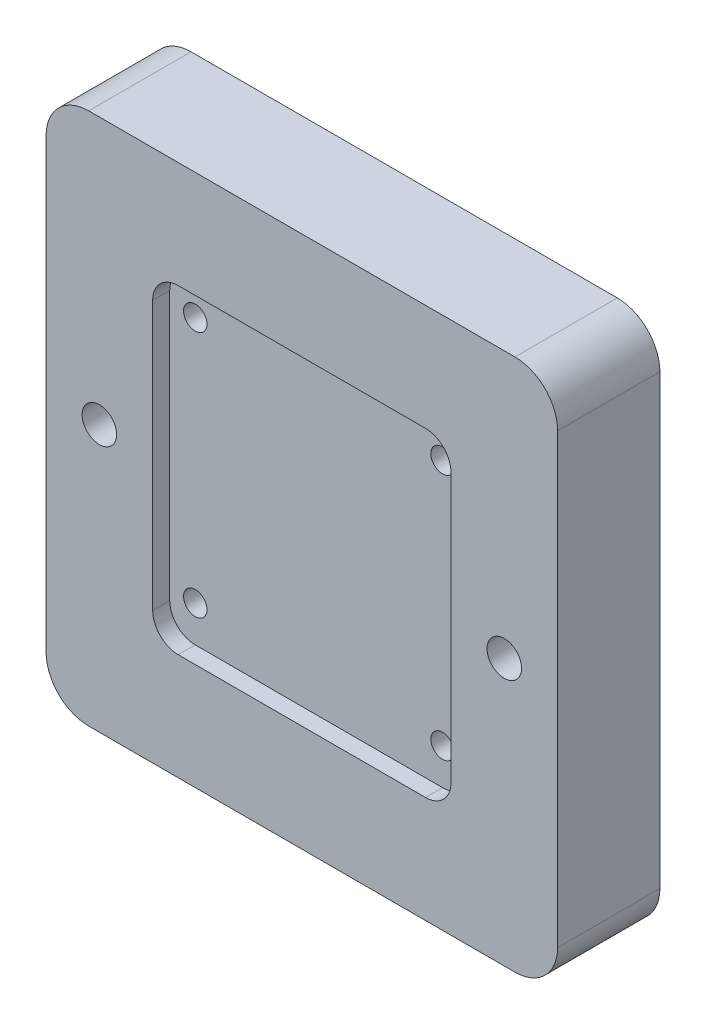
from build123d import *

# Parameters (mm, degrees)
BOSS_EXTRUDE1_DEPTH     = 4
BOSS_EXTRUDE2_DEPTH     = 20
CUT_EXTRUDE1_DEPTH      = 89.917096219
CUT_EXTRUDE1_DEPTH_BACK = 89.917096219
SKETCH8_R               = 2.75
CUT_EXTRUDE2_START      = -7
CUT_EXTRUDE2_DEPTH      = 97.901334807
CUT_EXTRUDE3_DEPTH      = 90.901334807
CUT_EXTRUDE3_DEPTH_BACK = 20
SKETCH10_R              = 4.05


with BuildPart() as part:
    # Sketch1 → Boss-Extrude1 (new body)
    with BuildSketch(Plane.XY):
        with BuildLine():
            Line((-50, 62.5), (50, 62.5))
            ThreePointArc((50, 62.5), (57.071067812, 59.571067812), (60, 52.5))
            Line((60, 52.5), (60, -52.5))
            ThreePointArc((60, -52.5), (57.071067812, -59.571067812), (50, -62.5))
            Line((50, -62.5), (-50, -62.5))
            ThreePointArc((-50, -62.5), (-57.071067812, -59.571067812), (-60, -52.5))
            Line((-60, -52.5), (-60, 52.5))
            ThreePointArc((-60, 52.5), (-57.071067812, 59.571067812), (-50, 62.5))
        make_face()
        with BuildLine():
            Line((-29, 37.5), (29, 37.5))
            ThreePointArc((29, 37.5), (33.242640687, 35.742640687), (35, 31.5))
            Line((35, 31.5), (35, -31.5))
            ThreePointArc((35, -31.5), (33.242640687, -35.742640687), (29, -37.5))
            Line((29, -37.5), (-29, -37.5))
            ThreePointArc((-29, -37.5), (-33.242640687, -35.742640687), (-35, -31.5))
            Line((-35, -31.5), (-35, 31.5))
            ThreePointArc((-35, 31.5), (-33.242640687, 35.742640687), (-29, 37.5))
        make_face(mode=Mode.SUBTRACT)
    extrude(amount=-BOSS_EXTRUDE1_DEPTH)

    # Sketch2 → Boss-Extrude2 (add)
    with BuildSketch(Plane.XY.offset(-4)):
        with BuildLine():
            Line((-50, -62.5), (50, -62.5))
            ThreePointArc((50, -62.5), (57.071067812, -59.571067812), (60, -52.5))
            Line((60, -52.5), (60, 52.5))
            ThreePointArc((60, 52.5), (57.071067812, 59.571067812), (50, 62.5))
            Line((50, 62.5), (-50, 62.5))
            ThreePointArc((-50, 62.5), (-57.071067812, 59.571067812), (-60, 52.5))
            Line((-60, 52.5), (-60, -52.5))
            ThreePointArc((-60, -52.5), (-57.071067812, -59.571067812), (-50, -62.5))
        make_face()
    extrude(amount=-BOSS_EXTRUDE2_DEPTH)

    # Sketch8 → Cut-Extrude1 (cut, two sides: drawn at the far end of the back side and taken through both)
    with BuildSketch(Plane.XY.offset(-4).offset(-CUT_EXTRUDE1_DEPTH_BACK)):
        with Locations((-29, 29)):
            Circle(SKETCH8_R)
        with Locations((29, 29)):
            Circle(SKETCH8_R)
        with Locations((29, -29)):
            Circle(SKETCH8_R)
        with Locations((-29, -29)):
            Circle(SKETCH8_R)
    extrude(amount=CUT_EXTRUDE1_DEPTH + CUT_EXTRUDE1_DEPTH_BACK, mode=Mode.SUBTRACT)

    # Sketch9 → Cut-Extrude2 (cut)
    with BuildSketch(Plane(origin=(0, 0, -24), x_dir=(-1, 0, 0), z_dir=(0, 0, -1)).offset(CUT_EXTRUDE2_START)):
        Polygon((-33.1, 26.632863896), (-29, 24.265727793), (-24.9, 26.632863896), (-24.9, 31.367136104), (-29, 33.734272207), (-33.1, 31.367136104), align=None)
    cut_extrude2 = extrude(amount=CUT_EXTRUDE2_DEPTH, mode=Mode.SUBTRACT)

    # Sketch-Pattern1: Cut-Extrude2 at 3 more places
    with Locations((-58, 0, 0), (0, -58, 0), (-58, -58, 0)):
        add(cut_extrude2, mode=Mode.SUBTRACT)

    # Sketch10 → Cut-Extrude3 (cut, two sides: drawn at the far end of the back side and taken through both)
    with BuildSketch(Plane.XY.offset(-CUT_EXTRUDE3_DEPTH_BACK)):
        with Locations((47.5, 0)):
            Circle(SKETCH10_R)
        with Locations((-47.5, 0)):
            Circle(SKETCH10_R)
    extrude(amount=CUT_EXTRUDE3_DEPTH + CUT_EXTRUDE3_DEPTH_BACK, mode=Mode.SUBTRACT)


solid = part.part
